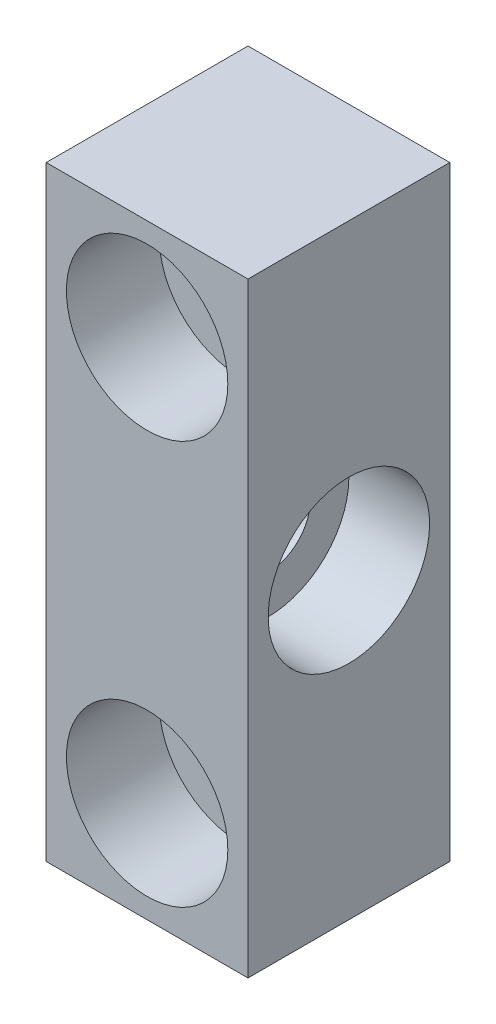
from build123d import *

# Parameters (mm, degrees)
SKETCH_1_W                = 10
SKETCH_1_H                = 30
EXTRUDE_1_DEPTH           = 10
HOLE_WIZARD_1_D           = 4.5
HOLE_WIZARD_1_CBORE_D     = 8
HOLE_WIZARD_1_CBORE_DEPTH = 4.6
HOLE_WIZARD_4_2_4_2_1_D   = 4.2
SKETCH_6_R                = 4
CUT_EXTRUDE_1_DEPTH       = 4


with BuildPart() as part:
    # 草图1 → 凸台-拉伸1 (new body)
    with BuildSketch(Plane.XY):
        Rectangle(SKETCH_1_W, SKETCH_1_H)
    extrude(amount=EXTRUDE_1_DEPTH)

    # 打孔尺寸(%根据)内六角圆柱头螺钉的类型1 (through all)
    with Locations(Plane.XY.offset(10)):
        with Locations((0, 10), (0, -10)):
            CounterBoreHole(HOLE_WIZARD_1_D / 2, HOLE_WIZARD_1_CBORE_D / 2, HOLE_WIZARD_1_CBORE_DEPTH)

    # Ø4.2 (4.2) 直径孔1 (through all)
    with Locations(Plane(origin=(5, 0, 0), x_dir=(0, 0, -1), z_dir=(1, 0, 0))):
        with Locations((-5, 0)):
            Hole(HOLE_WIZARD_4_2_4_2_1_D / 2)

    # 草图6 → 切除-拉伸1 (cut)
    with BuildSketch(Plane(origin=(5, 0, 0), x_dir=(0, 0, -1), z_dir=(1, 0, 0))):
        with Locations((-5, 0)):
            Circle(SKETCH_6_R)
    extrude(amount=-CUT_EXTRUDE_1_DEPTH, mode=Mode.SUBTRACT)


solid = part.part
